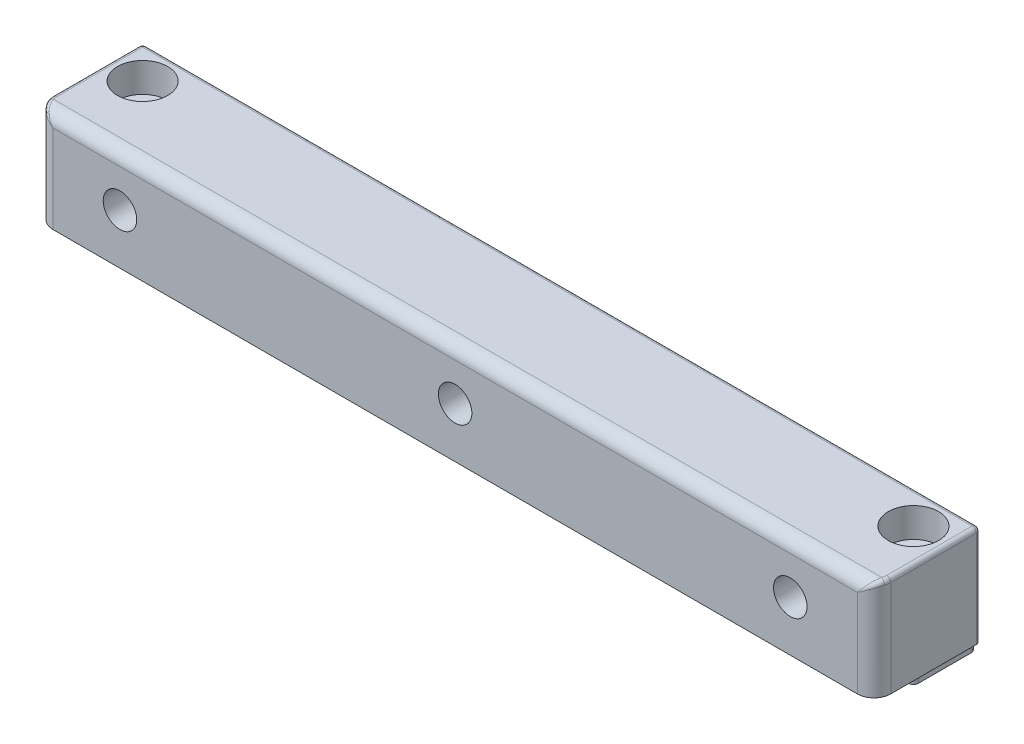
from build123d import *

# Parameters (mm, degrees)
SKETCH1_W           = 100
SKETCH1_H           = 12.7
SKETCH1_R           = 1.75
BOSS_EXTRUDE1_DEPTH = 12
SKETCH2_R           = 3
CUT_EXTRUDE1_DEPTH  = 3.5
SKETCH3_R           = 1.6
CUT_EXTRUDE2_DEPTH  = 50
SKETCH4_R           = 2
CUT_EXTRUDE3_DEPTH  = 7
FILLET1_R           = 2
FILLET2_R           = 1.5
BOSS_EXTRUDE2_START = 0.8
SKETCH5_W           = 7.5
SKETCH5_H           = 7.5
SKETCH5_R           = 1.75
BOSS_EXTRUDE2_DEPTH = 0.8
FILLET3_R           = 0.6
FILLET4_R           = 0.5


with BuildPart() as part:
    # Sketch1 → Boss-Extrude1 (new body)
    with BuildSketch(Plane(origin=(0, 0, 0), x_dir=(1, 0, 0), z_dir=(0, 1, 0))):
        with Locations((0, -2.35)):
            Rectangle(SKETCH1_W, SKETCH1_H)
        with Locations(Location((46, 0, 0), (0, 0, 270))):
            Circle(SKETCH1_R, mode=Mode.SUBTRACT)
        with Locations(Location((-46, 0, 0), (0, 0, 90))):
            Circle(SKETCH1_R, mode=Mode.SUBTRACT)
    extrude(amount=BOSS_EXTRUDE1_DEPTH)

    # Sketch2 → Cut-Extrude1 (cut)
    with BuildSketch(Plane(origin=(0, 12, 0), x_dir=(1, 0, 0), z_dir=(0, 1, 0))):
        with Locations(Location((46, 0, 0), (0, 0, 270))):
            Circle(SKETCH2_R)
        with Locations(Location((-46, 0, 0), (0, 0, 270))):
            Circle(SKETCH2_R)
    extrude(amount=-CUT_EXTRUDE1_DEPTH, mode=Mode.SUBTRACT)

    # Sketch3 → Cut-Extrude2 (cut)
    with BuildSketch(Plane.XY.offset(8.7)):
        with Locations((40, 6)):
            Circle(SKETCH3_R)
        with Locations((0, 6)):
            Circle(SKETCH3_R)
        with Locations((-40, 6)):
            Circle(SKETCH3_R)
    extrude(amount=-CUT_EXTRUDE2_DEPTH, mode=Mode.SUBTRACT)

    # Sketch4 → Cut-Extrude3 (cut)
    with BuildSketch(Plane(origin=(0, 0, 8.7), x_dir=(-1, 0, 0), z_dir=(0, 0, -1))):
        with Locations((40, 6)):
            Circle(SKETCH4_R)
        with Locations((0, 6)):
            Circle(SKETCH4_R)
        with Locations((-40, 6)):
            Circle(SKETCH4_R)
    extrude(amount=CUT_EXTRUDE3_DEPTH, mode=Mode.SUBTRACT)

    # Fillet1
    fillet1_edges = [part.edges().sort_by_distance(p)[0] for p in [
        (50, 6, 8.7),
        (-50, 6, 8.7),
    ]]
    fillet(fillet1_edges, radius=FILLET1_R)

    # Fillet2
    # the kernel refuses this fillet: 1.5 mm, written as the material it takes off along each edge
    with BuildSketch(Plane(origin=(-51.75, 12, 8.7), x_dir=(0, -1, 0), z_dir=(1, 0, 0))) as fillet2_piece_1:
        with BuildLine():
            CenterArc((FILLET2_R, FILLET2_R), FILLET2_R, 180, 90)
            Line((0, FILLET2_R), (0, 0))
            Line((0, 0), (FILLET2_R, 0))
        make_face()
    extrude(amount=103.5, mode=Mode.SUBTRACT)

    # Sketch5 → Boss-Extrude2 (add)
    # profile 1 of 2: a face of its own
    with BuildSketch(Plane.XZ.offset(BOSS_EXTRUDE2_START)):
        with Locations((-46, 0)):
            Rectangle(SKETCH5_W, SKETCH5_H)
        with Locations(Location((-46, 0, 0), (0, 0, 270))):
            Circle(SKETCH5_R, mode=Mode.SUBTRACT)
    # profile 2 of 2: a face of its own
    with BuildSketch(Plane.XZ.offset(BOSS_EXTRUDE2_START)):
        with Locations((46, 0)):
            Rectangle(SKETCH5_W, SKETCH5_H)
        with Locations(Location((46, 0, 0), (0, 0, 90))):
            Circle(SKETCH5_R, mode=Mode.SUBTRACT)
    extrude(amount=-BOSS_EXTRUDE2_DEPTH)

    # Fillet3
    fillet3_edges = [part.edges().sort_by_distance(p)[0] for p in [
        (42.25, -0.4, 3.75),
        (42.25, -0.4, -3.75),
        (49.75, -0.4, -3.75),
        (49.75, -0.4, 3.75),
        (-49.75, -0.4, 3.75),
        (-49.75, -0.4, -3.75),
        (-42.25, -0.4, -3.75),
        (-42.25, -0.4, 3.75),
    ]]
    fillet(fillet3_edges, radius=FILLET3_R)

    # Fillet4
    fillet4_edges = [part.edges().sort_by_distance(p)[0] for p in [
        (-50, 12, 1.35),
        (50, 12, 1.35),
        (-49.984059393, 12, 6.952008585),
        (-50, 6, -4),
        (50, 6, -4),
        (49.984059393, 12, 6.952008585),
        (49.135184903, 11.467090552, 8.346619324),
        (-49.135184903, 11.467090552, 8.346619324),
        (0, 12, -4),
    ]]
    fillet(fillet4_edges, radius=FILLET4_R)


solid = part.part
